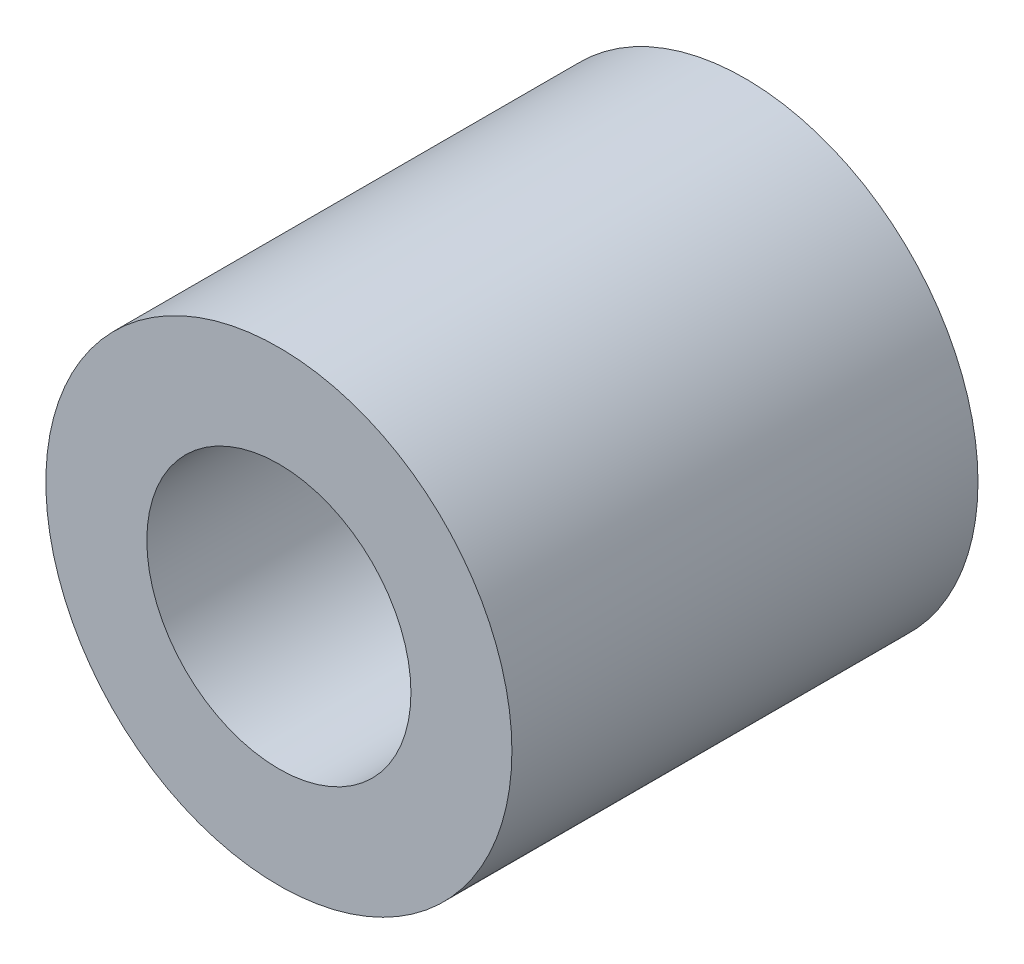
from build123d import *

# Parameters (mm, degrees)
SKETCH1_R            = 3
BOSS_EXTRUDE1_DEPTH  = 6
M3_CLEARANCE_HOLE1_D = 3.4


with BuildPart() as part:
    # Sketch1 → Boss-Extrude1 (new body)
    with BuildSketch(Plane.XY):
        Circle(SKETCH1_R)
    extrude(amount=BOSS_EXTRUDE1_DEPTH)

    # M3 Clearance Hole1 (through all)
    with Locations(Plane.XY.offset(6)):
        with Locations((0, 0)):
            Hole(M3_CLEARANCE_HOLE1_D / 2)


solid = part.part
